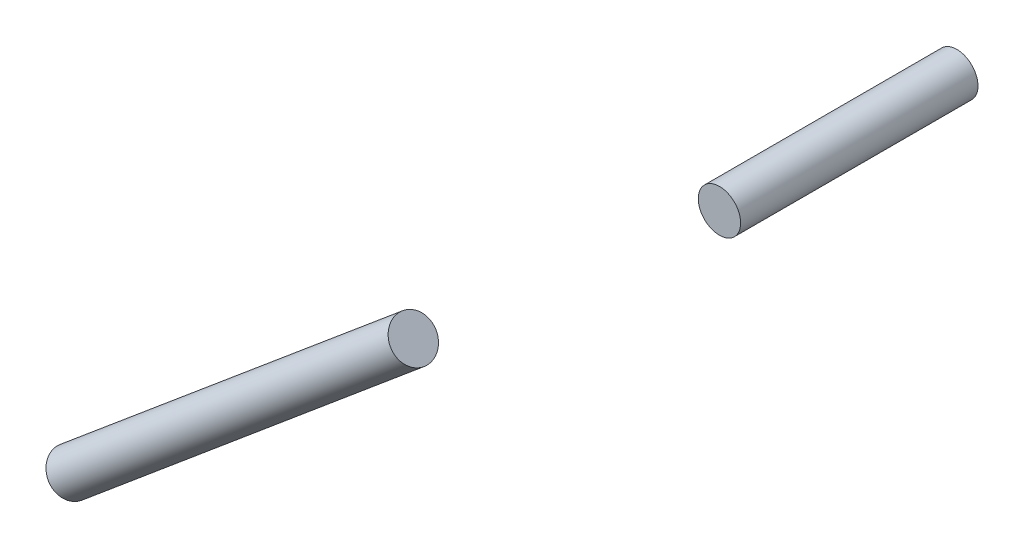
from build123d import *

# Parameters (mm, degrees)
BOSS_EXTRUDE1_OUTLINE_R = 6.35
BOSS_EXTRUDE1_DEPTH     = 133.833102677
SKETCH3_R               = 6.35
BOSS_EXTRUDE2_DEPTH     = 71.1581


# Read off the part's stored shape, not the designer's step: Boss-Extrude1
with BuildPart() as part:
    # Boss-Extrude1 outline → Boss-Extrude1 (new body)
    with BuildSketch(Plane(origin=(-181.126806004, -151.8320933, 0), x_dir=(0, 0, -1), z_dir=(0.7663596576395599, 0.6424117644802098, 0))):
        with Locations((-61.5061, 0)):
            Circle(BOSS_EXTRUDE1_OUTLINE_R)
    extrude(amount=BOSS_EXTRUDE1_DEPTH)


with BuildPart() as body_2:
    # Sketch3 → Boss-Extrude2 (new body)
    with BuildSketch(Plane(origin=(0, 0, 48.2981), x_dir=(-1, 0, 0), z_dir=(0, 0, -1))):
        with Locations(Location((0, 0, 0), (0, 0, 180))):
            Circle(SKETCH3_R)
    extrude(amount=BOSS_EXTRUDE2_DEPTH)


solid = Compound([part.part, body_2.part])
